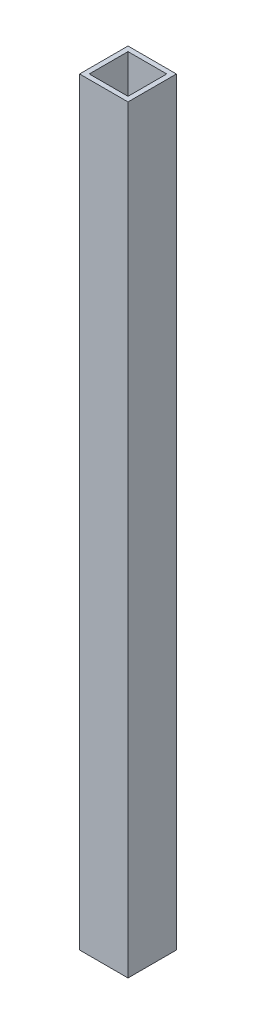
from build123d import *

# Parameters (mm, degrees)
SKETCH1_W           = 15
SKETCH1_H           = 15
SKETCH1_W_2         = 12
SKETCH1_H_2         = 12
EXTRUDE_THIN1_DEPTH = 235


with BuildPart() as part:
    # Sketch1 → Extrude-Thin1 (new body)
    with BuildSketch(Plane(origin=(0, 0, 0), x_dir=(1, 0, 0), z_dir=(0, 1, 0))):
        with Locations((7.5, 7.5)):
            Rectangle(SKETCH1_W, SKETCH1_H)
        with Locations((7.5, 7.5)):
            Rectangle(SKETCH1_W_2, SKETCH1_H_2, mode=Mode.SUBTRACT)
    extrude(amount=EXTRUDE_THIN1_DEPTH)


solid = part.part
